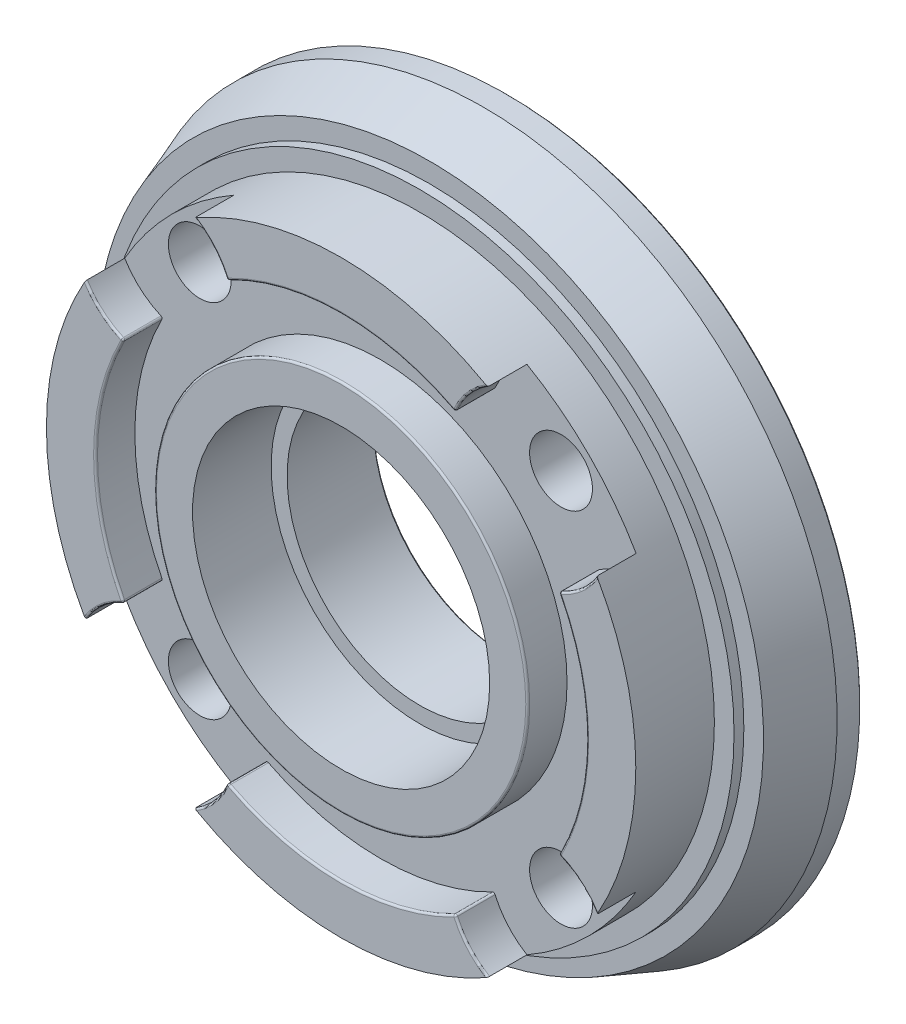
from build123d import *

# Parameters (mm, degrees)
BOSS_EXTRUDE1_DEPTH     = 2
BOSS_EXTRUDE1_2_DEPTH   = 2
BOSS_EXTRUDE1_3_DEPTH   = 2
BOSS_EXTRUDE1_4_DEPTH   = 2
SKETCH1_R               = 9.5
SKETCH1_R_2             = 7.5625
BOSS_EXTRUDE1_5_DEPTH   = 2
BOSS_EXTRUDE2_START     = -2
SKETCH2_R               = 15
BOSS_EXTRUDE2_DEPTH     = 2
FILLET1_R               = 0.1
FILLET2_R               = 0.1
SKETCH4_R               = 16
BOSS_EXTRUDE3_DEPTH     = 0.5
SKETCH5_R               = 18
BOSS_EXTRUDE4_DEPTH     = 4
CUT_EXTRUDE2_DEPTH      = 26.850531909
CUT_EXTRUDE2_DEPTH_BACK = 26.850531909
SKETCH3_R               = 1.6
SKETCH6_R               = 2.1
CUT_EXTRUDE3_DEPTH      = 4
SKETCH7_R               = 2.1
CUT_EXTRUDE4_DEPTH      = 4
SKETCH8_R               = 6.75
MIDDLE_CUTOUT_DEPTH     = 7
CHAMFER1_SIZE           = 0.1
CUT_EXTRUDE6_START      = -2
SKETCH9_R               = 7.5625
CUT_EXTRUDE6_DEPTH      = 2
CHAMFER2_SIZE           = 1
CHAMFER2_SIZE2          = 2.747477419


with BuildPart() as part:
    # Sketch1 → Boss-Extrude1 (new body)
    with BuildSketch(Plane.XY):
        with BuildLine():
            ThreePointArc((5.795745748, 11.075167323), (6.469207051, 12.179609111), (7.456549067, 13.01537076))
            ThreePointArc((7.456549067, 13.01537076), (0, 15), (-7.456549067, 13.01537076))
            ThreePointArc((-7.456549067, 13.01537076), (-6.469207051, 12.179609111), (-5.795745748, 11.075167323))
            ThreePointArc((-5.795745748, 11.075167323), (0, 12.5), (5.795745748, 11.075167323))
        make_face()
    extrude(amount=BOSS_EXTRUDE1_DEPTH)



with BuildPart() as body_2:
    # Sketch1 → Boss-Extrude1 2 (new body)
    with BuildSketch(Plane.XY):
        with BuildLine():
            ThreePointArc((13.01537076, -7.456549067), (14.495353762, -3.858071967), (15, 0))
            ThreePointArc((15, 0), (14.495353762, 3.858071967), (13.01537076, 7.456549067))
            ThreePointArc((13.01537076, 7.456549067), (12.179609111, 6.469207051), (11.075167323, 5.795745748))
            ThreePointArc((11.075167323, 5.795745748), (12.5, 0), (11.075167323, -5.795745748))
            ThreePointArc((11.075167323, -5.795745748), (12.179609111, -6.469207051), (13.01537076, -7.456549067))
        make_face()
    extrude(amount=BOSS_EXTRUDE1_2_DEPTH)


with BuildPart() as body_3:
    # Sketch1 → Boss-Extrude1 3 (new body)
    with BuildSketch(Plane.XY):
        with BuildLine():
            ThreePointArc((-7.456549067, -13.01537076), (0, -15), (7.456549067, -13.01537076))
            ThreePointArc((7.456549067, -13.01537076), (6.469207051, -12.179609111), (5.795745748, -11.075167323))
            ThreePointArc((5.795745748, -11.075167323), (0, -12.5), (-5.795745748, -11.075167323))
            ThreePointArc((-5.795745748, -11.075167323), (-6.469207051, -12.179609111), (-7.456549067, -13.01537076))
        make_face()
    extrude(amount=BOSS_EXTRUDE1_3_DEPTH)


with BuildPart() as body_4:
    # Sketch1 → Boss-Extrude1 4 (new body)
    with BuildSketch(Plane.XY):
        with BuildLine():
            ThreePointArc((-11.075167323, 5.795745748), (-12.179609111, 6.469207051), (-13.01537076, 7.456549067))
            ThreePointArc((-13.01537076, 7.456549067), (-15, 0), (-13.01537076, -7.456549067))
            ThreePointArc((-13.01537076, -7.456549067), (-12.179609111, -6.469207051), (-11.075167323, -5.795745748))
            ThreePointArc((-11.075167323, -5.795745748), (-12.5, 0), (-11.075167323, 5.795745748))
        make_face()
    extrude(amount=BOSS_EXTRUDE1_4_DEPTH)


with BuildPart() as body_5:
    # Sketch1 → Boss-Extrude1 5 (new body)
    with BuildSketch(Plane.XY):
        Circle(SKETCH1_R)
        Circle(SKETCH1_R_2, mode=Mode.SUBTRACT)
    extrude(amount=BOSS_EXTRUDE1_5_DEPTH)


with BuildPart() as part_1:
    add(part.part)

    add(body_2.part)  # Boss-Extrude2 merges body 2

    add(body_3.part)  # Boss-Extrude2 merges body 3

    add(body_4.part)  # Boss-Extrude2 merges body 4

    add(body_5.part)  # Boss-Extrude2 merges body 5
    # Sketch2 → Boss-Extrude2 (add)
    with BuildSketch(Plane.XY.offset(BOSS_EXTRUDE2_START)):
        with Locations(Location((0, 0, 0), (0, 0, 150.191461703))):
            Circle(SKETCH2_R)
    extrude(amount=BOSS_EXTRUDE2_DEPTH)

    # Fillet1
    fillet1_edges = [part_1.edges().sort_by_distance(p)[0] for p in [
        (11.075167323, 5.795745748, 1),
        (11.075167323, -5.795745748, 1),
        (5.795745748, -11.075167323, 1),
        (-5.795745748, -11.075167323, 1),
        (-11.075167323, -5.795745748, 1),
        (-11.075167323, 5.795745748, 1),
        (5.795745748, 11.075167323, 1),
        (-5.795745748, 11.075167323, 1),
    ]]
    fillet(fillet1_edges, radius=FILLET1_R)

    # Fillet2
    fillet2_edges = [part_1.edges().sort_by_distance(p)[0] for p in [
        (6.504180663, 12.219925602, 2),
        (12.219925602, -6.504180663, 2),
        (-6.504180663, -12.219925602, 2),
        (-12.219925602, 6.504180663, 2),
        (-9.5, 0, 2),
        (0, -12.5, 2),
        (6.504180663, -12.219925602, 2),
        (5.779303749, -11.119440592, 2),
        (-5.779303749, -11.119440592, 2),
        (12.5, 0, 2),
        (12.219925602, 6.504180663, 2),
        (11.119440592, 5.779303749, 2),
        (11.119440592, -5.779303749, 2),
        (0, 12.5, 2),
        (-6.504180663, 12.219925602, 2),
        (-5.779303749, 11.119440592, 2),
        (5.779303749, 11.119440592, 2),
        (-12.5, 0, 2),
        (-12.219925602, -6.504180663, 2),
        (-11.119440592, -5.779303749, 2),
        (-11.119440592, 5.779303749, 2),
    ]]
    fillet(fillet2_edges, radius=FILLET2_R - 0.0001)  # a hair under: the kernel refuses the full size

    # Sketch4 → Boss-Extrude3 (add)
    with BuildSketch(Plane(origin=(0, 0, -2), x_dir=(-1, 0, 0), z_dir=(0, 0, -1))):
        Circle(SKETCH4_R)
    extrude(amount=BOSS_EXTRUDE3_DEPTH)

    # Sketch5 → Boss-Extrude4 (add)
    with BuildSketch(Plane(origin=(0, 0, -2.5), x_dir=(-1, 0, 0), z_dir=(0, 0, -1))):
        Circle(SKETCH5_R)
    extrude(amount=BOSS_EXTRUDE4_DEPTH)

    # Sketch3 → Cut-Extrude2 (cut, two sides: drawn at the far end of the back side and taken through both)
    with BuildSketch(Plane(origin=(0, 0, -2), x_dir=(-1, 0, 0), z_dir=(0, 0, -1)).offset(-CUT_EXTRUDE2_DEPTH_BACK)):
        with Locations((-9.192388155, 9.192388155)):
            Circle(SKETCH3_R)
        with Locations((9.192388155, 9.192388155)):
            Circle(SKETCH3_R)
        with Locations((9.192388155, -9.192388155)):
            Circle(SKETCH3_R)
        with Locations((-9.192388155, -9.192388155)):
            Circle(SKETCH3_R)
    extrude(amount=CUT_EXTRUDE2_DEPTH + CUT_EXTRUDE2_DEPTH_BACK, mode=Mode.SUBTRACT)

    # Sketch6 → Cut-Extrude3 (cut)
    with BuildSketch(Plane(origin=(0, 0, -6.5), x_dir=(-1, 0, 0), z_dir=(0, 0, -1))):
        with Locations((-9.192388155, 9.192388155)):
            Circle(SKETCH6_R)
        with Locations((9.192388155, 9.192388155)):
            Circle(SKETCH6_R)
        with Locations((9.192388155, -9.192388155)):
            Circle(SKETCH6_R)
        with Locations((-9.192388155, -9.192388155)):
            Circle(SKETCH6_R)
    extrude(amount=-CUT_EXTRUDE3_DEPTH, mode=Mode.SUBTRACT)

    # Sketch7 → Cut-Extrude4 (cut)
    with BuildSketch(Plane(origin=(0, 0, -6.5), x_dir=(-1, 0, 0), z_dir=(0, 0, -1))):
        with Locations((0, 13)):
            Circle(SKETCH7_R)
        with Locations((13, 0)):
            Circle(SKETCH7_R)
        with Locations((0, -13)):
            Circle(SKETCH7_R)
        with Locations((-13, 0)):
            Circle(SKETCH7_R)
    extrude(amount=-CUT_EXTRUDE4_DEPTH, mode=Mode.SUBTRACT)

    # Sketch8 → Middle Cutout (cut)
    with BuildSketch(Plane.XY):
        Circle(SKETCH8_R)
    extrude(amount=-MIDDLE_CUTOUT_DEPTH, mode=Mode.SUBTRACT)

    # Chamfer1
    chamfer1_edges = [part_1.edges().sort_by_distance(p)[0] for p in [
        (18, 0, -6.5),
        (-6.75, 0, -6.5),
    ]]
    chamfer(chamfer1_edges, length=CHAMFER1_SIZE)

    # Sketch9 → Cut-Extrude6 (cut)
    with BuildSketch(Plane.XY.offset(CUT_EXTRUDE6_START)):
        Circle(SKETCH9_R)
    extrude(amount=CUT_EXTRUDE6_DEPTH, mode=Mode.SUBTRACT)

    # Chamfer2
    chamfer2_edges = [part_1.edges().sort_by_distance(p)[0] for p in [
        (18, 0, -2.5),
    ]]
    chamfer2_side = [part_1.faces().sort_by_distance(p)[0] for p in [
        (17.490883118, 0, -2.5),
    ]]
    chamfer(chamfer2_edges, length=CHAMFER2_SIZE, length2=CHAMFER2_SIZE2, reference=chamfer2_side[0])


solid = part_1.part
